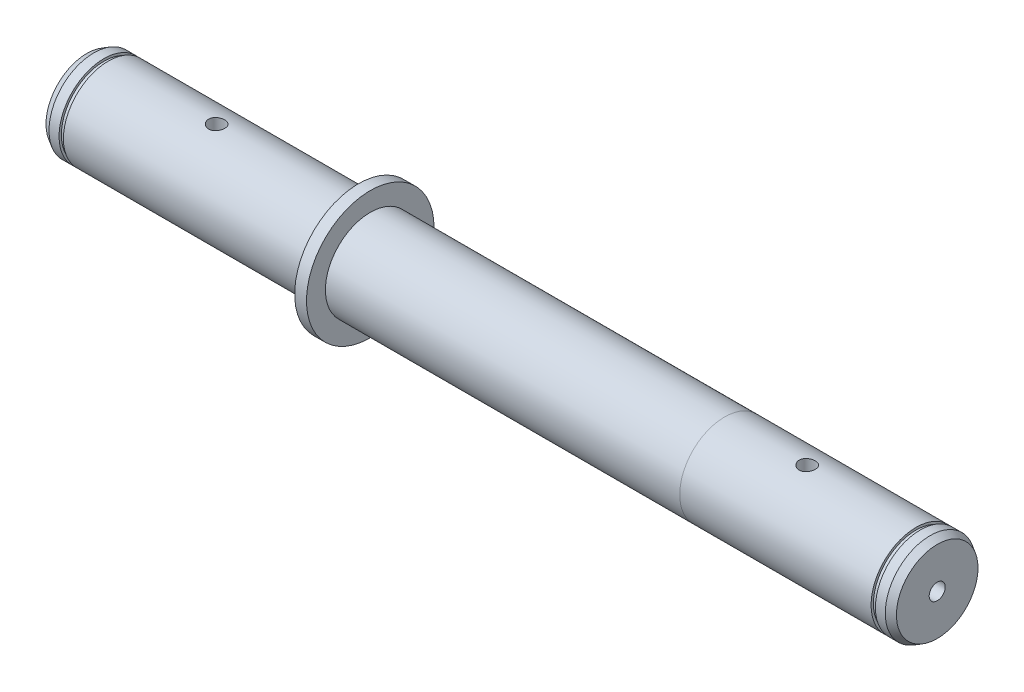
from build123d import *
from OCP.BRepFilletAPI import BRepFilletAPI_MakeChamfer

# Parameters (mm, degrees)
M8_TAPPED_HOLE1_D             = 6.8
M8_TAPPED_HOLE1_DEPTH         = 65
M8_TAPPED_HOLE1_TIP           = 2.042926105
SKIZZE18_W                    = 3.4
SKIZZE18_H                    = 27
M8_GEWINDEBOHRUNG3_AT_2_COUNT = 2
M8_GEWINDEBOHRUNG3_AT_2_PITCH = 250
SPIEGELN2_COPY_1_SKETCH_W     = 3.4
SPIEGELN2_COPY_1_SKETCH_H     = 27
SKIZZE19_W                    = 1.85
SKIZZE19_H                    = 1
SKIZZE20_W                    = 1.85
SKIZZE20_H                    = 1
M8_TAPPED_HOLE2_D             = 6.8
M8_TAPPED_HOLE2_DEPTH         = 65
M8_TAPPED_HOLE2_TIP           = 2.042926105
FASE1_SIZE                    = 3
FASE1_SIZE2                   = 1.732050808


with BuildPart() as part:
    # Skizze1 → Rotation1 (revolve)
    with BuildSketch(Plane.XY):
        Polygon((180, 19), (180, 0), (-180, 0), (-180, 19), (-65, 19), (-65, 27), (-60, 27), (-60, 19.0001), (90, 19.0001), align=None)
    revolve(axis=Axis((180, 0, 0), (-1, 0, 0)))

    # M8 Tapped Hole1
    with Locations(Plane(origin=(180, 0, 0), x_dir=(0, 0, -1), z_dir=(1, 0, 0))):
        with Locations((0, 0)):
            Hole(M8_TAPPED_HOLE1_D / 2, depth=M8_TAPPED_HOLE1_DEPTH)
            with Locations((0, 0, -(M8_TAPPED_HOLE1_DEPTH + M8_TAPPED_HOLE1_TIP / 2))):  # 118° drill point
                Cone(0, M8_TAPPED_HOLE1_D / 2, M8_TAPPED_HOLE1_TIP, mode=Mode.SUBTRACT)

    # Skizze18 → M8 Gewindebohrung3 (revolve, cut)
    with BuildSketch(Plane(origin=(-125, 0, 0), x_dir=(0, 0, -1), z_dir=(1, 0, 0))):
        with Locations((1.7, 13.5)):
            Rectangle(SKIZZE18_W, SKIZZE18_H)
    m8_gewindebohrung3 = revolve(axis=Axis((-125, -6.35, 0), (0, 1, 0)), mode=Mode.SUBTRACT)

    # M8 Gewindebohrung3 at 2: M8 Gewindebohrung3 ×2
    with Locations(*[(i * M8_GEWINDEBOHRUNG3_AT_2_PITCH, 0, 0) for i in range(1, M8_GEWINDEBOHRUNG3_AT_2_COUNT)]):
        add(m8_gewindebohrung3, mode=Mode.SUBTRACT)

    # Spiegeln2: M8 Gewindebohrung3 across plane
    add(m8_gewindebohrung3.mirror(Plane.ZX), mode=Mode.SUBTRACT)

    # Spiegeln2 copy 1 sketch → Spiegeln2 copy 1 (revolve, cut)
    with BuildSketch(Plane(origin=(125, 0, 0), x_dir=(0, 0, -1), z_dir=(1, 0, 0))):
        with Locations((1.7, -13.5)):
            Rectangle(SPIEGELN2_COPY_1_SKETCH_W, SPIEGELN2_COPY_1_SKETCH_H)
    revolve(axis=Axis((125, 6.35, 0), (0, 1, 0)), mode=Mode.SUBTRACT)

    # Skizze19 → Schnitt-Rotation1 (revolve, cut)
    with BuildSketch(Plane.XY):
        with Locations((171.925, 18.5)):
            Rectangle(SKIZZE19_W, SKIZZE19_H)
    revolve(axis=Axis((-88.99, 0, 0), (1, 0, 0)), mode=Mode.SUBTRACT)

    # Skizze20 → Schnitt-Rotation2 (revolve, cut)
    with BuildSketch(Plane.XY):
        with Locations((-171.825, 18.5)):
            Rectangle(SKIZZE20_W, SKIZZE20_H)
    revolve(axis=Axis((-88.99, 0, 0), (1, 0, 0)), mode=Mode.SUBTRACT)

    # M8 Tapped Hole2
    with Locations(Plane.ZY.offset(180)):
        with Locations((0, 0)):
            Hole(M8_TAPPED_HOLE2_D / 2, depth=M8_TAPPED_HOLE2_DEPTH)
            with Locations((0, 0, -(M8_TAPPED_HOLE2_DEPTH + M8_TAPPED_HOLE2_TIP / 2))):  # 118° drill point
                Cone(0, M8_TAPPED_HOLE2_D / 2, M8_TAPPED_HOLE2_TIP, mode=Mode.SUBTRACT)

    # Fase1: one chamfer whose edges measure the first distance from different faces: ONE call of the kernel's chamfer builder (chamfer() names one face for all edges)
    fase1_edges_1 = [part.edges().sort_by_distance(p)[0] for p in [
        (180, -19, 0),
    ]]
    fase1_side_1 = [part.faces().sort_by_distance(p)[0] for p in [
        (176.425, -19.0001, 0),
    ]]
    fase1_edges_2 = [part.edges().sort_by_distance(p)[0] for p in [
        (-180, -19, 0),
    ]]
    fase1_side_2 = [part.faces().sort_by_distance(p)[0] for p in [
        (-176.375, -19, 0),
    ]]
    fase1 = BRepFilletAPI_MakeChamfer(part.part.solid().wrapped)
    for e in fase1_edges_1:
        fase1.Add(FASE1_SIZE, FASE1_SIZE2, e.wrapped, fase1_side_1[0].wrapped)  # the first distance lies on this face
    for e in fase1_edges_2:
        fase1.Add(FASE1_SIZE, FASE1_SIZE2, e.wrapped, fase1_side_2[0].wrapped)  # the first distance lies on this face
    add(Compound.cast(fase1.Shape()), mode=Mode.REPLACE)


solid = part.part
